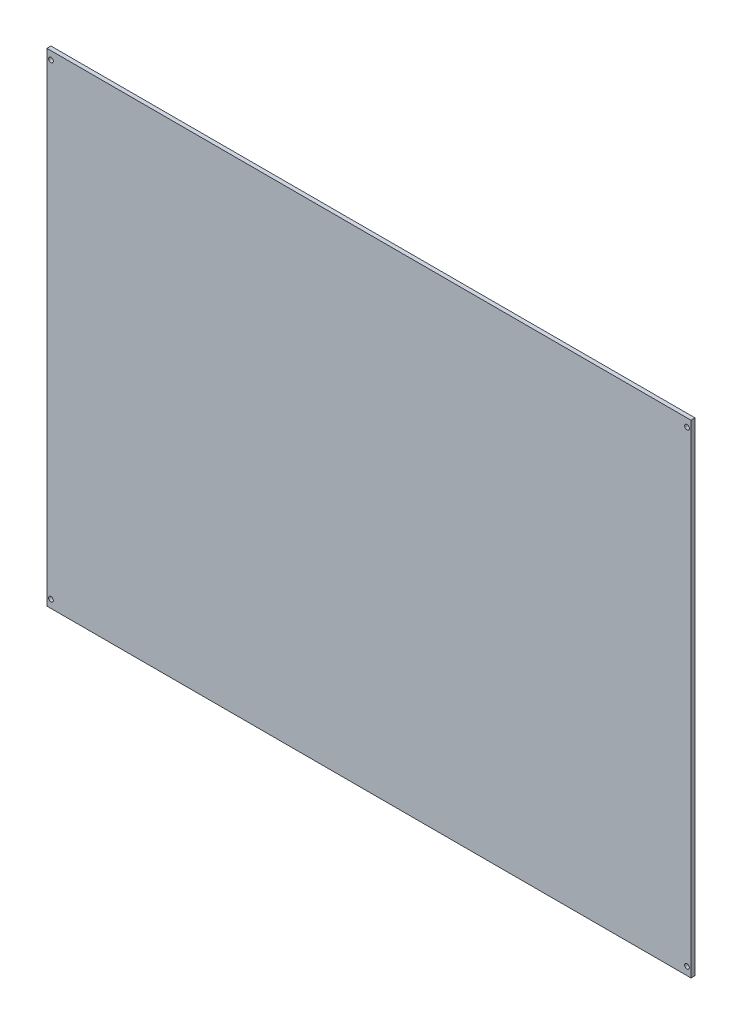
from build123d import *

# Parameters (mm, degrees)
SKETCH1_W           = 508
SKETCH1_H           = 381
BOSS_EXTRUDE1_DEPTH = 3.175
SKETCH2_R           = 1.8542
CUT_EXTRUDE1_DEPTH  = 3.175


with BuildPart() as part:
    # Sketch1 → Boss-Extrude1 (new body)
    with BuildSketch(Plane.XY):
        Rectangle(SKETCH1_W, SKETCH1_H)
    extrude(amount=BOSS_EXTRUDE1_DEPTH)

    # Sketch2 → Cut-Extrude1 (cut)
    with BuildSketch(Plane.XY.offset(3.175)):
        with Locations((-250.825, -184.15)):
            Circle(SKETCH2_R)
        with Locations((-250.825, 184.15)):
            Circle(SKETCH2_R)
        with Locations((250.825, 184.15)):
            Circle(SKETCH2_R)
        with Locations((250.825, -184.15)):
            Circle(SKETCH2_R)
    extrude(amount=-CUT_EXTRUDE1_DEPTH, mode=Mode.SUBTRACT)


solid = part.part
